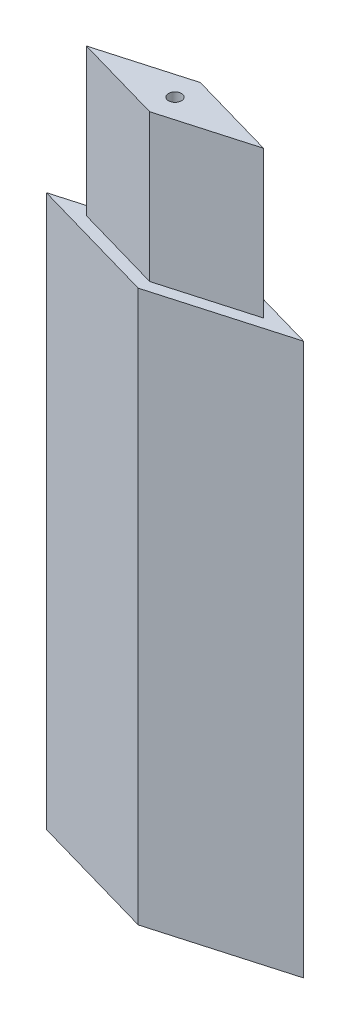
from build123d import *

# Parameters (mm, degrees)
SWEEP_1_DEPTH            = 610
CUT_EXTRUDE_2_DEPTH      = 12
SKETCH_21_R              = 1.75
CUT_EXTRUDE_3_DEPTH      = 600
CUT_EXTRUDE_4_DEPTH      = 691.959477934
CUT_EXTRUDE_4_DEPTH_BACK = 691.959477934
SKETCH_26_OUTSIDE_W      = 208.38
SKETCH_26_OUTSIDE_H      = 816.38
SKETCH_26_OUTSIDE_W_2    = 70
SKETCH_26_OUTSIDE_H_2    = 190
CUT_EXTRUDE_5_DEPTH      = 41
SKETCH_28_OUTSIDE_W      = 112.694
SKETCH_28_OUTSIDE_H      = 62.694
CUT_EXTRUDE_7_DEPTH      = 40


# Read off the part's stored shape, not the designer's step: 扫描1
with BuildPart() as part:
    # 扫描1 outline → 扫描1 (new body)
    with BuildSketch(Plane(origin=(0, 0, 0), x_dir=(1, 0, 0), z_dir=(0, 1, 0))):
        Polygon((-35, 0), (35, 0), (0, 10), align=None)
    sweep_1 = extrude(amount=SWEEP_1_DEPTH)

    # 草图1 → 放样1 section 0
    with BuildSketch(Plane.XY, mode=Mode.PRIVATE) as loft_1_s0:
        with BuildLine():
            Line((-35, 610), (0, 690))
            Line((0, 690), (35, 610))
            Line((35, 610), (-35, 610))
        make_face()
    loft_1 = loft([Vertex(0, 610, -10), loft_1_s0.sketch])

    # 镜向1: 扫描1, 放样1 across plane
    add(sweep_1.mirror(Plane.XY))
    add(loft_1.mirror(Plane.XY))

    # 草图19 → 切除-拉伸2 (cut)
    with BuildSketch(Plane.XZ):
        Polygon((0, -10), (35, 0), (0, 10), (-35, 0), align=None)
    extrude(amount=-CUT_EXTRUDE_2_DEPTH, mode=Mode.SUBTRACT)

    # 草图21 → 切除-拉伸3 (cut)
    with BuildSketch(Plane.XZ.offset(-12)):
        with Locations(Location((0, 0, 0), (0, 0, 270))):
            Circle(SKETCH_21_R)
    extrude(amount=-CUT_EXTRUDE_3_DEPTH, mode=Mode.SUBTRACT)

    # 草图26 outside → 切除-拉伸4 (cut, two sides: drawn at the far end of the back side and taken through both)
    with BuildSketch(Plane.XY.offset(-CUT_EXTRUDE_4_DEPTH_BACK)):
        with Locations((0, 351)):
            Rectangle(SKETCH_26_OUTSIDE_W, SKETCH_26_OUTSIDE_H)
        with Locations((0, 487)):
            Rectangle(SKETCH_26_OUTSIDE_W_2, SKETCH_26_OUTSIDE_H_2, mode=Mode.SUBTRACT)
    extrude(amount=CUT_EXTRUDE_4_DEPTH + CUT_EXTRUDE_4_DEPTH_BACK, mode=Mode.SUBTRACT)

    # 草图27 → 切除-拉伸5 (cut)
    with BuildSketch(Plane.XZ.offset(-392)):
        Polygon((24.807846155, 0), (0, 7.087956044), (-24.807846155, 0), (0, -7.087956044), align=None)
    extrude(amount=-CUT_EXTRUDE_5_DEPTH, mode=Mode.SUBTRACT)

    # 草图28 outside → 切除-拉伸7 (cut)
    with BuildSketch(Plane(origin=(0, 582, 0), x_dir=(1, 0, 0), z_dir=(0, 1, 0))):
        Rectangle(SKETCH_28_OUTSIDE_W, SKETCH_28_OUTSIDE_H)
        Polygon((0, 6.879952905), (-24.079835166, 0), (0, -6.879952905), (24.079835166, 0), align=None, mode=Mode.SUBTRACT)
    extrude(amount=-CUT_EXTRUDE_7_DEPTH, mode=Mode.SUBTRACT)


solid = part.part
